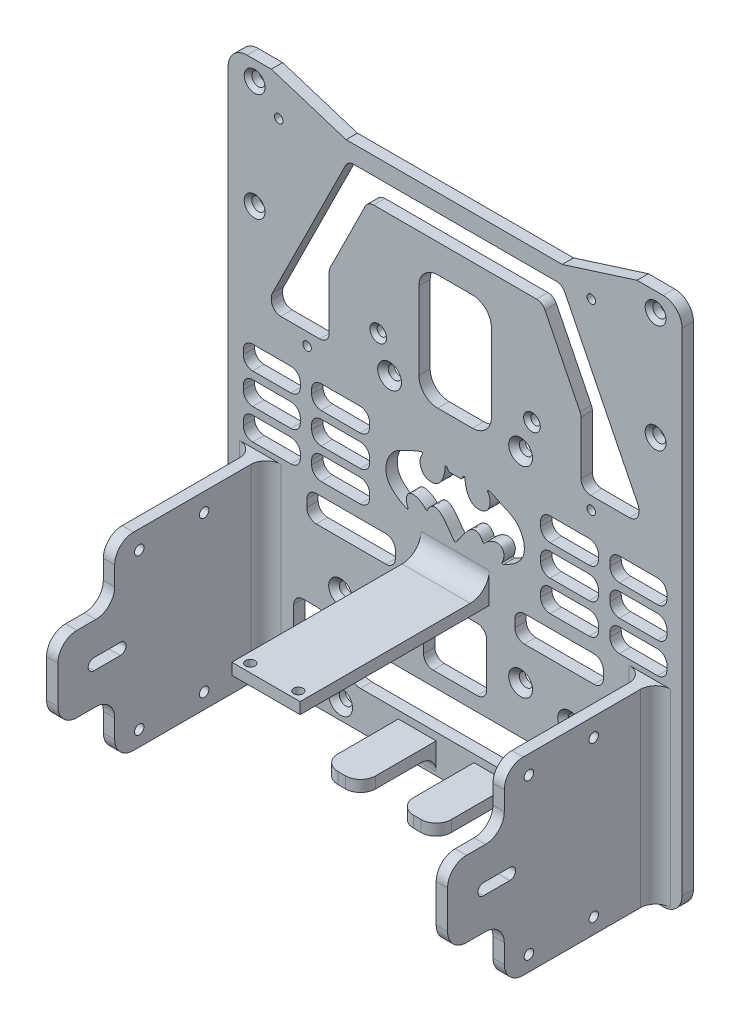
from build123d import *

# Parameters (mm, degrees)
SKETCH1_W                                         = 120
SKETCH1_H                                         = 140
BOSS_EXTRUDE1_DEPTH                               = 1.5
SKETCH8_R                                         = 1.125
CUT_EXTRUDE3_DEPTH                                = 93.244241013
SKETCH14_W                                        = 18.035382012
SKETCH14_H                                        = 3
BOSS_EXTRUDE6_DEPTH                               = 50
SKETCH14_3_W                                      = 3
SKETCH14_3_H                                      = 50
BOSS_EXTRUDE7_DEPTH                               = 55
SKETCH14_4_W                                      = 10
SKETCH14_4_H                                      = 3
BOSS_EXTRUDE8_DEPTH                               = 20
CUT_EXTRUDE7_DEPTH                                = 109.130707942
CUT_EXTRUDE7_DEPTH_BACK                           = 109.130707942
SKETCH17_W                                        = 60
SKETCH17_H                                        = 10
CUT_EXTRUDE8_DEPTH                                = 10
SKETCH18_R                                        = 1.75
SKETCH18_R_2                                      = 1.25
CUT_EXTRUDE9_DEPTH                                = 109.921990553
CSK_FOR_M3_FLAT_HEAD_MACHINE_SCREW1_D             = 3.4
CSK_FOR_M3_FLAT_HEAD_MACHINE_SCREW1_DEPTH         = 25.4
CSK_FOR_M3_FLAT_HEAD_MACHINE_SCREW1_CSINK_D       = 6.3
CSK_FOR_M3_FLAT_HEAD_MACHINE_SCREW1_CSINK_ANGLE   = 90
CSK_FOR_M3_FLAT_HEAD_MACHINE_SCREW1_TIP           = 1.021463052
CSK_FOR_M2_FLAT_HEAD_MACHINE_SCREW1_D             = 2.4
CSK_FOR_M2_FLAT_HEAD_MACHINE_SCREW1_DEPTH         = 25.4
CSK_FOR_M2_FLAT_HEAD_MACHINE_SCREW1_CSINK_D       = 4.4
CSK_FOR_M2_FLAT_HEAD_MACHINE_SCREW1_CSINK_ANGLE   = 90
CSK_FOR_M2_FLAT_HEAD_MACHINE_SCREW1_TIP           = 0.721032743
SKETCH22_R                                        = 1.25
CUT_EXTRUDE10_DEPTH                               = 10
SKETCH23_R                                        = 1.75
CUT_EXTRUDE11_DEPTH                               = 109.921990553
CSK_FOR_M2_5_FLAT_HEAD_MACHINE_SCREW1_D           = 2.9
CSK_FOR_M2_5_FLAT_HEAD_MACHINE_SCREW1_DEPTH       = 25.4
CSK_FOR_M2_5_FLAT_HEAD_MACHINE_SCREW1_CSINK_D     = 5.5
CSK_FOR_M2_5_FLAT_HEAD_MACHINE_SCREW1_CSINK_ANGLE = 90
CSK_FOR_M2_5_FLAT_HEAD_MACHINE_SCREW1_TIP         = 0.871247898
SKETCH26_R                                        = 1.25
SKETCH26_W                                        = 15
SKETCH26_H                                        = 15
CUT_EXTRUDE12_DEPTH                               = 10
FILLET1_R                                         = 5
FILLET7_R                                         = 4
SKETCH28_W                                        = 33.396168195
SKETCH28_H                                        = 6.127733404
SKETCH28_W_2                                      = 8.596935275
SKETCH28_H_2                                      = 12.89032694
SKETCH28_W_3                                      = 23.399651005
SKETCH28_H_3                                      = 6.97820762
SKETCH28_W_4                                      = 19.180612278
SKETCH28_H_4                                      = 30.524090818
SKETCH28_W_5                                      = 16.701549584
SKETCH28_H_5                                      = 16.540911189
CUT_EXTRUDE14_DEPTH                               = 108.354552889
FILLET9_R                                         = 5
SKETCH29_W                                        = 3
SKETCH29_H                                        = 22.383200212
BOSS_EXTRUDE9_DEPTH                               = 3
FILLET8_R                                         = 2.5
FILLET10_R                                        = 0.254


with BuildPart() as part:
    # Sketch1 → Boss-Extrude1 (new, symmetric)
    with BuildSketch(Plane.XY):
        Rectangle(SKETCH1_W, SKETCH1_H)
    extrude(amount=BOSS_EXTRUDE1_DEPTH, both=True)

    # Sketch8 → Cut-Extrude3 (cut, through all)
    with BuildSketch(Plane(origin=(0, 0, -1.5), x_dir=(-1, 0, 0), z_dir=(0, 0, -1))):
        with Locations((39.133, 11.319886599)):
            Circle(SKETCH8_R)
        with Locations((-36, 11.319886599)):
            Circle(SKETCH8_R)
        with Locations((46.626, 59.655886599)):
            Circle(SKETCH8_R)
        with Locations((-36, 59.655886599)):
            Circle(SKETCH8_R)
    extrude(amount=-CUT_EXTRUDE3_DEPTH, mode=Mode.SUBTRACT)

    # Sketch14 → Boss-Extrude6 (add)
    with BuildSketch(Plane.XY.offset(1.5)):
        with Locations((0, -22.5)):
            Rectangle(SKETCH14_W, SKETCH14_H)
    extrude(amount=BOSS_EXTRUDE6_DEPTH)

    # Sketch14<3> → Boss-Extrude7 (add)
    with BuildSketch(Plane.XY.offset(1.5)):
        with Locations((-51.5, -44.204434517)):
            Rectangle(SKETCH14_3_W, SKETCH14_3_H)
        with Locations((51.5, -44.204434517)):
            Rectangle(SKETCH14_3_W, SKETCH14_3_H)
    extrude(amount=BOSS_EXTRUDE7_DEPTH)

    # Sketch14<4> → Boss-Extrude8 (add)
    with BuildSketch(Plane.XY.offset(1.5)):
        with Locations((-10, -63.5)):
            Rectangle(SKETCH14_4_W, SKETCH14_4_H)
        with Locations((10, -63.5)):
            Rectangle(SKETCH14_4_W, SKETCH14_4_H)
    extrude(amount=BOSS_EXTRUDE8_DEPTH)

    # Sketch16 → Cut-Extrude7 (cut, two sides: drawn at the far end of the back side and taken through both)
    with BuildSketch(Plane(origin=(0, 0, 0), x_dir=(-1, 0, 0), z_dir=(0, 0, 1)).offset(-CUT_EXTRUDE7_DEPTH_BACK)):
        with BuildLine():
            Line((-2.676997375, -3.115491339), (-1.661620411, -1.255994944))
            Line((-1.661620411, -1.255994944), (1.661620411, -1.255994944))
            Line((1.661620411, -1.255994944), (2.676997375, -3.115491339))
            add(Edge.make_bspline(
                [(8.147636418, -2.312360356), (9.7516919, -1.052650449), (9.494995926, 3.145560382), (3.209368707, 3.872784764), (2.409404806, -1.403132511), (2.676997375, -3.115491339)],
                knots=[0, 0, 0, 0, 0.364366643, 0.544855149, 1, 1, 1, 1], degree=3))
            add(Edge.make_bspline(
                [(11.976305499, 13.090102298), (14.164245959, 12.17087839), (20.116859035, 9.039455262), (17.474522851, 1.323700805), (11.684603781, -0.921831055), (9.865519745, -2.215229576), (8.147636418, -2.312360356)],
                knots=[0, 0, 0, 0, 0.340304626, 0.702583149, 0.768552686, 1, 1, 1, 1], degree=3))
            add(Edge.make_bspline(
                [(7.504615307, 10.728035124), (7.998951966, 9.746754242), (11.301694838, 7.48724266), (13.429294273, 10.454422883), (12.424024884, 12.682931139), (11.976305499, 13.090102298)],
                knots=[0, 0, 0, 0, 0.522512368, 0.683657936, 1, 1, 1, 1], degree=3))
            add(Edge.make_bspline(
                [(0, 14.048815026), (1.029098505, 13.219503974), (2.848960845, 9.379730204), (5.915593911, 8.368421967), (6.804683013, 9.142334289), (7.504615307, 10.728035124)],
                knots=[0, 0, 0, 0, 0.60666758, 0.653394575, 1, 1, 1, 1], degree=3))
            add(Edge.make_bspline(
                [(0, 14.048815026), (-1.029098505, 13.219503974), (-2.848960845, 9.379730204), (-5.915593911, 8.368421967), (-6.804683013, 9.142334289), (-7.504615307, 10.728035124)],
                knots=[0, 0, 0, 0, 0.60666758, 0.653394575, 1, 1, 1, 1], degree=3))
            add(Edge.make_bspline(
                [(-7.504615307, 10.728035124), (-7.998951966, 9.746754242), (-11.301694838, 7.48724266), (-13.429294273, 10.454422883), (-12.424024884, 12.682931139), (-11.976305499, 13.090102298)],
                knots=[0, 0, 0, 0, 0.522512368, 0.683657936, 1, 1, 1, 1], degree=3))
            add(Edge.make_bspline(
                [(-11.976305499, 13.090102298), (-14.164245959, 12.17087839), (-20.116859035, 9.039455262), (-17.474522851, 1.323700805), (-11.684603781, -0.921831055), (-9.865519745, -2.215229576), (-8.147636418, -2.312360356)],
                knots=[0, 0, 0, 0, 0.340304626, 0.702583149, 0.768552686, 1, 1, 1, 1], degree=3))
            add(Edge.make_bspline(
                [(-8.147636418, -2.312360356), (-9.7516919, -1.052650449), (-9.494995926, 3.145560382), (-3.209368707, 3.872784764), (-2.409404806, -1.403132511), (-2.676997375, -3.115491339)],
                knots=[0, 0, 0, 0, 0.364366643, 0.544855149, 1, 1, 1, 1], degree=3))
        make_face()
    extrude(amount=CUT_EXTRUDE7_DEPTH + CUT_EXTRUDE7_DEPTH_BACK, mode=Mode.SUBTRACT)

    # Sketch17 → Cut-Extrude8 (cut)
    with BuildSketch(Plane.XY.offset(1.5)):
        with Locations((0, -55)):
            Rectangle(SKETCH17_W, SKETCH17_H)
    extrude(amount=-CUT_EXTRUDE8_DEPTH, mode=Mode.SUBTRACT)

    # Sketch18 → Cut-Extrude9 (cut, through all)
    with BuildSketch(Plane(origin=(0, 0, -1.5), x_dir=(-1, 0, 0), z_dir=(0, 0, -1))):
        with Locations((30.276577062, -65.619747364)):
            Circle(SKETCH18_R)
        with Locations((30.276577062, -40.619747364)):
            Circle(SKETCH18_R)
        with Locations((-30.276577062, -65.619747364)):
            Circle(SKETCH18_R)
        with Locations((-30.276577062, -40.619747364)):
            Circle(SKETCH18_R)
        with Locations((17.322124308, -37.56288796)):
            Circle(SKETCH18_R)
        with Locations((-17.322124308, -37.56288796)):
            Circle(SKETCH18_R)
        with Locations((17.322124308, 15.43711204)):
            Circle(SKETCH18_R)
        with Locations((-17.322124308, 15.43711204)):
            Circle(SKETCH18_R)
        with Locations((20.32, 23.647125219)):
            Circle(SKETCH18_R_2)
        with Locations((-20.32, 23.647125219)):
            Circle(SKETCH18_R_2)
    extrude(amount=-CUT_EXTRUDE9_DEPTH, mode=Mode.SUBTRACT)

    # CSK for M3 Flat Head Machine Screw1
    with Locations(Plane.XY.offset(1.5)):
        with Locations((30.276577062, -40.619747364), (17.322124308, -37.56288796), (-17.322124308, -37.56288796), (-30.276577062, -40.619747364), (-30.276577062, -65.619747364), (30.276577062, -65.619747364), (-17.322124308, 15.43711204), (17.322124308, 15.43711204)):
            CounterSinkHole(CSK_FOR_M3_FLAT_HEAD_MACHINE_SCREW1_D / 2, CSK_FOR_M3_FLAT_HEAD_MACHINE_SCREW1_CSINK_D / 2, depth=CSK_FOR_M3_FLAT_HEAD_MACHINE_SCREW1_DEPTH, counter_sink_angle=CSK_FOR_M3_FLAT_HEAD_MACHINE_SCREW1_CSINK_ANGLE)
            with Locations((0, 0, -(CSK_FOR_M3_FLAT_HEAD_MACHINE_SCREW1_DEPTH + CSK_FOR_M3_FLAT_HEAD_MACHINE_SCREW1_TIP / 2))):  # 118° drill point
                Cone(0, CSK_FOR_M3_FLAT_HEAD_MACHINE_SCREW1_D / 2, CSK_FOR_M3_FLAT_HEAD_MACHINE_SCREW1_TIP, mode=Mode.SUBTRACT)

    # CSK for M2 Flat Head Machine Screw1
    with Locations(Plane(origin=(-20.32, 23.647125219, 1.5), x_dir=(1, 0, 0), z_dir=(0, 0, 1))):
        with Locations((0, 0), (40.64, 0)):
            CounterSinkHole(CSK_FOR_M2_FLAT_HEAD_MACHINE_SCREW1_D / 2, CSK_FOR_M2_FLAT_HEAD_MACHINE_SCREW1_CSINK_D / 2, depth=CSK_FOR_M2_FLAT_HEAD_MACHINE_SCREW1_DEPTH, counter_sink_angle=CSK_FOR_M2_FLAT_HEAD_MACHINE_SCREW1_CSINK_ANGLE)
            with Locations((0, 0, -(CSK_FOR_M2_FLAT_HEAD_MACHINE_SCREW1_DEPTH + CSK_FOR_M2_FLAT_HEAD_MACHINE_SCREW1_TIP / 2))):  # 118° drill point
                Cone(0, CSK_FOR_M2_FLAT_HEAD_MACHINE_SCREW1_D / 2, CSK_FOR_M2_FLAT_HEAD_MACHINE_SCREW1_TIP, mode=Mode.SUBTRACT)

    # Sketch22 → Cut-Extrude10 (cut)
    with BuildSketch(Plane(origin=(0, -21, 0), x_dir=(1, 0, 0), z_dir=(0, 1, 0))):
        with Locations(Location((6.35, -49.3, 0), (0, 0, 270))):
            Circle(SKETCH22_R)
        with Locations(Location((-6.35, -49.3, 0), (0, 0, 270))):
            Circle(SKETCH22_R)
    extrude(amount=-CUT_EXTRUDE10_DEPTH, mode=Mode.SUBTRACT)

    # Sketch23 → Cut-Extrude11 (cut, through all)
    with BuildSketch(Plane(origin=(0, 0, -1.5), x_dir=(-1, 0, 0), z_dir=(0, 0, -1))):
        with Locations((53, 65)):
            Circle(SKETCH23_R)
        with Locations((53, 36.425)):
            Circle(SKETCH23_R)
        with Locations((-53, 36.425)):
            Circle(SKETCH23_R)
        with Locations((-53, 65)):
            Circle(SKETCH23_R)
    extrude(amount=-CUT_EXTRUDE11_DEPTH, mode=Mode.SUBTRACT)

    # CSK for M2.5 Flat Head Machine Screw1
    with Locations(Plane.XY.offset(1.5)):
        with Locations((-53, 65), (-53, 36.425), (53, 65), (53, 36.425)):
            CounterSinkHole(CSK_FOR_M2_5_FLAT_HEAD_MACHINE_SCREW1_D / 2, CSK_FOR_M2_5_FLAT_HEAD_MACHINE_SCREW1_CSINK_D / 2, depth=CSK_FOR_M2_5_FLAT_HEAD_MACHINE_SCREW1_DEPTH, counter_sink_angle=CSK_FOR_M2_5_FLAT_HEAD_MACHINE_SCREW1_CSINK_ANGLE)
            with Locations((0, 0, -(CSK_FOR_M2_5_FLAT_HEAD_MACHINE_SCREW1_DEPTH + CSK_FOR_M2_5_FLAT_HEAD_MACHINE_SCREW1_TIP / 2))):  # 118° drill point
                Cone(0, CSK_FOR_M2_5_FLAT_HEAD_MACHINE_SCREW1_D / 2, CSK_FOR_M2_5_FLAT_HEAD_MACHINE_SCREW1_TIP, mode=Mode.SUBTRACT)

    # Sketch26 → Cut-Extrude12 (cut)
    with BuildSketch(Plane(origin=(53, 0, 0), x_dir=(0, 0, -1), z_dir=(1, 0, 0))):
        with Locations(Location((-34.992140171, -24.06995253, 0), (0, 0, 90))):
            Circle(SKETCH26_R)
        with Locations(Location((-17.847063763, -65.134481988, 0), (0, 0, 90))):
            Circle(SKETCH26_R)
        with Locations(Location((-34.992140171, -65.134481988, 0), (0, 0, 90))):
            Circle(SKETCH26_R)
        with Locations(Location((-17.847063763, -24.06995253, 0), (0, 0, 90))):
            Circle(SKETCH26_R)
        with Locations((-49, -61.704434517)):
            Rectangle(SKETCH26_W, SKETCH26_H)
        with Locations((-49, -26.704434517)):
            Rectangle(SKETCH26_W, SKETCH26_H)
        with BuildLine():
            Line((-40, -45.704434517), (-47, -45.704434517))
            ThreePointArc((-47, -45.704434517), (-48.5, -44.204434517), (-47, -42.704434517))
            Line((-47, -42.704434517), (-40, -42.704434517))
            ThreePointArc((-40, -42.704434517), (-38.5, -44.204434517), (-40, -45.704434517))
        make_face()
    cut_extrude12 = extrude(amount=-CUT_EXTRUDE12_DEPTH, mode=Mode.SUBTRACT)

    # Mirror3: Cut-Extrude12 across plane
    add(cut_extrude12.mirror(Plane(origin=(0, 0, 0), x_dir=(0, 0, 1), z_dir=(1, 0, 0))), mode=Mode.SUBTRACT)

    # Fillet1
    fillet1_edges = [part.edges().sort_by_distance(p)[0] for p in [
        (0, -21, 1.5),
        (51.5, -54.204434517, 56.5),
        (51.5, -54.204434517, 41.5),
        (51.5, -69.204434517, 41.5),
        (51.5, -34.204434517, 56.5),
        (51.5, -19.204434517, 41.5),
        (51.5, -34.204434517, 41.5),
        (-51.5, -54.204434517, 56.5),
        (-51.5, -69.204434517, 41.5),
        (-51.5, -54.204434517, 41.5),
        (-51.5, -19.204434517, 41.5),
        (-51.5, -34.204434517, 56.5),
        (-51.5, -34.204434517, 41.5),
        (-60, 70, 0),
        (60, 70, 0),
        (60, -70, 0),
        (-60, -70, 0),
    ]]
    fillet(fillet1_edges, radius=FILLET1_R)

    # Fillet7
    fillet7_edges = [part.edges().sort_by_distance(p)[0] for p in [
        (-53, -44.204434517, 1.5),
        (-50, -44.204434517, 1.5),
        (50, -44.204434517, 1.5),
        (53, -44.204434517, 1.5),
        (-10, -65, 1.5),
        (-15, -63.5, 21.5),
        (-5, -63.5, 21.5),
        (10, -65, 1.5),
        (5, -63.5, 21.5),
        (15, -63.5, 21.5),
    ]]
    fillet(fillet7_edges, radius=FILLET7_R)

    # Sketch28 → Cut-Extrude14 (cut, through all)
    with BuildSketch(Plane.XY.offset(1.5)):
        Polygon((-28.312812997, 59.098648751), (28.312812997, 59.098648751), (48.58758575, 18.272737472), (48.58758575, 14.634829942), (33.285311055, 14.634829942), (33.285311055, 31.8383908), (23.068877259, 52.410518777), (-23.068877259, 52.410518777), (-33.285311055, 31.8383908), (-33.285311055, 14.634829942), (-48.58758575, 14.634829942), (-48.58758575, 18.272737472), align=None)
        with Locations((-39.305118456, 1.503393518)):
            Rectangle(SKETCH28_W, SKETCH28_H)
        with Locations((-39.305118456, -6.624339886)):
            Rectangle(SKETCH28_W, SKETCH28_H)
        with Locations((-39.305118456, -14.75207329)):
            Rectangle(SKETCH28_W, SKETCH28_H)
        with Locations((-38.37359931, -53.55483653)):
            Rectangle(SKETCH28_W_2, SKETCH28_H_2)
        with Locations((-27.503582635, -24.701632225)):
            Rectangle(SKETCH28_W_3, SKETCH28_H_3)
        with Locations((27.503582635, -24.701632225)):
            Rectangle(SKETCH28_W_3, SKETCH28_H_3)
        with Locations((38.37359931, -53.55483653)):
            Rectangle(SKETCH28_W_2, SKETCH28_H_2)
        with Locations((39.305118456, -14.75207329)):
            Rectangle(SKETCH28_W, SKETCH28_H)
        with Locations((39.305118456, -6.624339886)):
            Rectangle(SKETCH28_W, SKETCH28_H)
        with Locations((39.305118456, 1.503393518)):
            Rectangle(SKETCH28_W, SKETCH28_H)
        Polygon((48.09508483, 70), (28.312812997, 63.73657731), (-28.805313918, 63.73657731), (-48.58758575, 70), align=None)
        with Locations((0, 29.634829942)):
            Rectangle(SKETCH28_W_4, SKETCH28_H_4)
        with Locations((0, -37.933690967)):
            Rectangle(SKETCH28_W_5, SKETCH28_H_5)
    extrude(amount=-CUT_EXTRUDE14_DEPTH, mode=Mode.SUBTRACT)

    # Fillet9
    fillet9_edges = [part.edges().sort_by_distance(p)[0] for p in [
        (30, -60, 0),
        (-30, -60, 0),
        (-30, -50, 0),
        (30, -50, 0),
        (-9.590306139, 14.372784533, 0),
        (9.590306139, 14.372784533, 0),
        (9.590306139, 44.896875351, 0),
        (-9.590306139, 44.896875351, 0),
    ]]
    fillet(fillet9_edges, radius=FILLET9_R - 0.0001)  # a hair under: the kernel refuses the full size

    # Sketch29 → Boss-Extrude9 (add)
    with BuildSketch(Plane(origin=(0, 0, -1.5), x_dir=(-1, 0, 0), z_dir=(0, 0, -1))):
        with Locations((-39.422951045, -6.624339886)):
            Rectangle(SKETCH29_W, SKETCH29_H)
        with Locations((39.422951045, -6.624339886)):
            Rectangle(SKETCH29_W, SKETCH29_H)
    extrude(amount=-BOSS_EXTRUDE9_DEPTH)

    # Fillet8
    fillet8_edges = [part.edges().sort_by_distance(p)[0] for p in [
        (37.922951045, -3.560473184, 0),
        (37.922951045, 4.56726022, 0),
        (40.922951045, -17.815939992, 0),
        (40.922951045, -3.560473184, 0),
        (37.922951045, -17.815939992, 0),
        (37.922951045, -11.688206588, 0),
        (37.922951045, -9.688206588, 0),
        (40.922951045, 4.56726022, 0),
        (40.922951045, -11.688206588, 0),
        (40.922951045, -9.688206588, 0),
        (-37.922951045, -1.560473184, 0),
        (-37.922951045, -3.560473184, 0),
        (-37.922951045, -17.815939992, 0),
        (-40.922951045, 4.56726022, 0),
        (-40.922951045, -1.560473184, 0),
        (-40.922951045, -3.560473184, 0),
        (-37.922951045, -9.688206588, 0),
        (-37.922951045, -11.688206588, 0),
        (-40.922951045, -17.815939992, 0),
        (-40.922951045, -9.688206588, 0),
        (-40.922951045, -11.688206588, 0),
        (-37.922951045, 4.56726022, 0),
        (-48.58758575, 18.272737472, 0),
        (-28.312812997, 59.098648751, 0),
        (28.312812997, 59.098648751, 0),
        (48.58758575, 18.272737472, 0),
        (48.58758575, 14.634829942, 0),
        (33.285311055, 14.634829942, 0),
        (33.285311055, 31.8383908, 0),
        (23.068877259, 52.410518777, 0),
        (-23.068877259, 52.410518777, 0),
        (-33.285311055, 31.8383908, 0),
        (-33.285311055, 14.634829942, 0),
        (-48.58758575, 14.634829942, 0),
        (-56.003202553, -1.560473184, 0),
        (-56.003202553, 4.56726022, 0),
        (-22.607034358, 4.56726022, 0),
        (-22.607034358, -1.560473184, 0),
        (-56.003202553, -9.688206588, 0),
        (-56.003202553, -3.560473184, 0),
        (-22.607034358, -3.560473184, 0),
        (-22.607034358, -9.688206588, 0),
        (-56.003202553, -17.815939992, 0),
        (-56.003202553, -11.688206588, 0),
        (-22.607034358, -11.688206588, 0),
        (-22.607034358, -17.815939992, 0),
        (-42.672066948, -60, 0),
        (-42.672066948, -47.10967306, 0),
        (-34.075131673, -47.10967306, 0),
        (-34.075131673, -60, 0),
        (-39.203408137, -28.190736035, 0),
        (-39.203408137, -21.212528415, 0),
        (-15.803757132, -21.212528415, 0),
        (-15.803757132, -28.190736035, 0),
        (15.803757132, -21.212528415, 0),
        (39.203408137, -21.212528415, 0),
        (39.203408137, -28.190736035, 0),
        (15.803757132, -28.190736035, 0),
        (34.075131673, -47.10967306, 0),
        (42.672066948, -47.10967306, 0),
        (42.672066948, -60, 0),
        (34.075131673, -60, 0),
        (22.607034358, -11.688206588, 0),
        (56.003202553, -11.688206588, 0),
        (56.003202553, -17.815939992, 0),
        (22.607034358, -17.815939992, 0),
        (22.607034358, -3.560473184, 0),
        (56.003202553, -3.560473184, 0),
        (56.003202553, -9.688206588, 0),
        (22.607034358, -9.688206588, 0),
        (22.607034358, 4.56726022, 0),
        (56.003202553, 4.56726022, 0),
        (56.003202553, -1.560473184, 0),
        (22.607034358, -1.560473184, 0),
        (8.350774792, -29.663235372, 0),
        (8.350774792, -46.204146561, 0),
        (-8.350774792, -46.204146561, 0),
        (-8.350774792, -29.663235372, 0),
        (40.922951045, -1.560473184, 0),
        (37.922951045, -1.560473184, 0),
    ]]
    fillet(fillet8_edges, radius=FILLET8_R)

    # Fillet10
    fillet10_edges = [part.edges().sort_by_distance(p)[0] for p in [
        (-11.976305499, -13.090102298, 0.75),
        (-2.676997375, 3.115491339, 0.75),
        (-1.661620411, 1.255994944, 0),
        (1.661620411, 1.255994944, 0),
        (2.676997375, 3.115491339, -0.75),
        (8.147636418, 2.312360356, 0.75),
        (11.976305499, -13.090102298, 0.75),
        (7.504615307, -10.728035124, 0.75),
        (0, -14.048815026, 0.75),
        (-7.504615307, -10.728035124, 0.75),
        (-8.147636418, 2.312360356, 0.75),
    ]]
    fillet(fillet10_edges, radius=FILLET10_R)


solid = part.part
